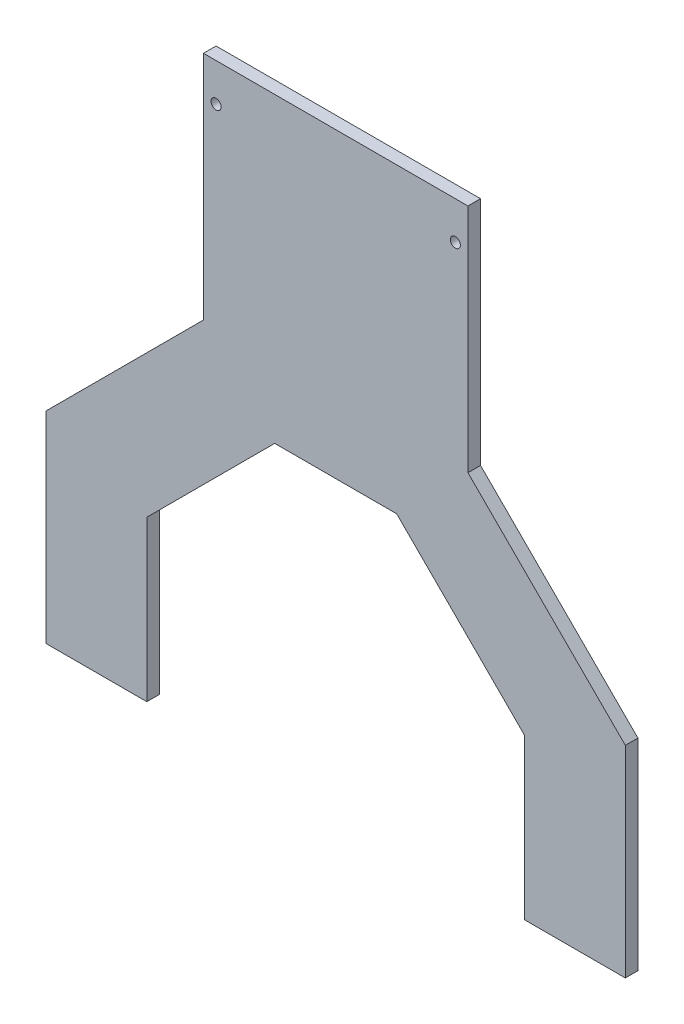
from build123d import *

# Parameters (mm, degrees)
SKETCH1_W           = 105
SKETCH1_H           = 120
SKETCH1_R           = 2
BOSS_EXTRUDE1_DEPTH = 5
BOSS_EXTRUDE2_DEPTH = 5


with BuildPart() as part:
    # Sketch1 → Boss-Extrude1 (new body)
    with BuildSketch(Plane.XY):
        Rectangle(SKETCH1_W, SKETCH1_H)
        with Locations((-47.5, 45)):
            Circle(SKETCH1_R, mode=Mode.SUBTRACT)
        with Locations((47.5, 45)):
            Circle(SKETCH1_R, mode=Mode.SUBTRACT)
    extrude(amount=BOSS_EXTRUDE1_DEPTH)

    # Sketch2 → Boss-Extrude2 (add)
    with BuildSketch(Plane.XY):
        Polygon((-24.215724685, -60), (-52.5, -31.715724685), (-115, -94.215728753), (-115, -174.215728753), (-75, -174.215728753), (-75, -110.78427201), align=None)
    boss_extrude2 = extrude(amount=BOSS_EXTRUDE2_DEPTH)

    # Mirror1: Boss-Extrude2 across plane
    add(boss_extrude2.mirror(Plane(origin=(0, 0, 0), x_dir=(0, 0, 1), z_dir=(1, 0, 0))))


solid = part.part
